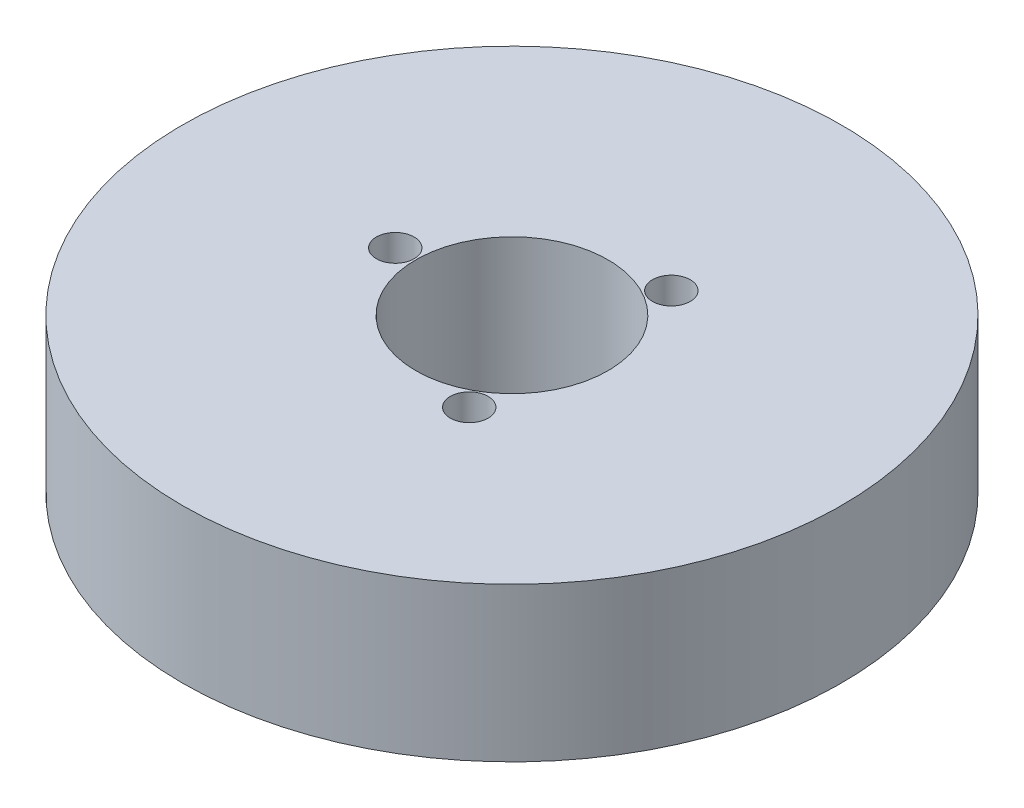
from build123d import *

# Parameters (mm, degrees)
SKETCH1_R           = 60
BOSS_EXTRUDE1_DEPTH = 28
SKETCH2_R           = 17.5
CUT_EXTRUDE1_DEPTH  = 90.353231615
SKETCH3_R           = 3.440672649
CUT_EXTRUDE2_DEPTH  = 20.430485337
CIRPATTERN1_COUNT   = 3


with BuildPart() as part:
    # Sketch1 → Boss-Extrude1 (new body)
    with BuildSketch(Plane(origin=(0, 0, 0), x_dir=(1, 0, 0), z_dir=(0, 1, 0))):
        Circle(SKETCH1_R)
    extrude(amount=BOSS_EXTRUDE1_DEPTH)

    # Sketch2 → Cut-Extrude1 (cut, through all)
    with BuildSketch(Plane(origin=(0, 0, 0), x_dir=(1, 0, 0), z_dir=(0, 1, 0))):
        Circle(SKETCH2_R)
    extrude(amount=CUT_EXTRUDE1_DEPTH, mode=Mode.SUBTRACT)

    # Sketch3 → Cut-Extrude2 (cut)
    with BuildSketch(Plane(origin=(0, 28, 0), x_dir=(1, 0, 0), z_dir=(0, 1, 0))):
        with Locations((-21.24444726, 0)):
            Circle(SKETCH3_R)
    cut_extrude2 = extrude(amount=-CUT_EXTRUDE2_DEPTH, mode=Mode.SUBTRACT)

    # CirPattern1: Cut-Extrude2 ×3 about axis
    cirpattern1_axis = Axis((0, 0, 0), (0, 1, 0))
    for i in range(1, CIRPATTERN1_COUNT):
        add(cut_extrude2.rotate(cirpattern1_axis, i * 360 / CIRPATTERN1_COUNT), mode=Mode.SUBTRACT)


solid = part.part
